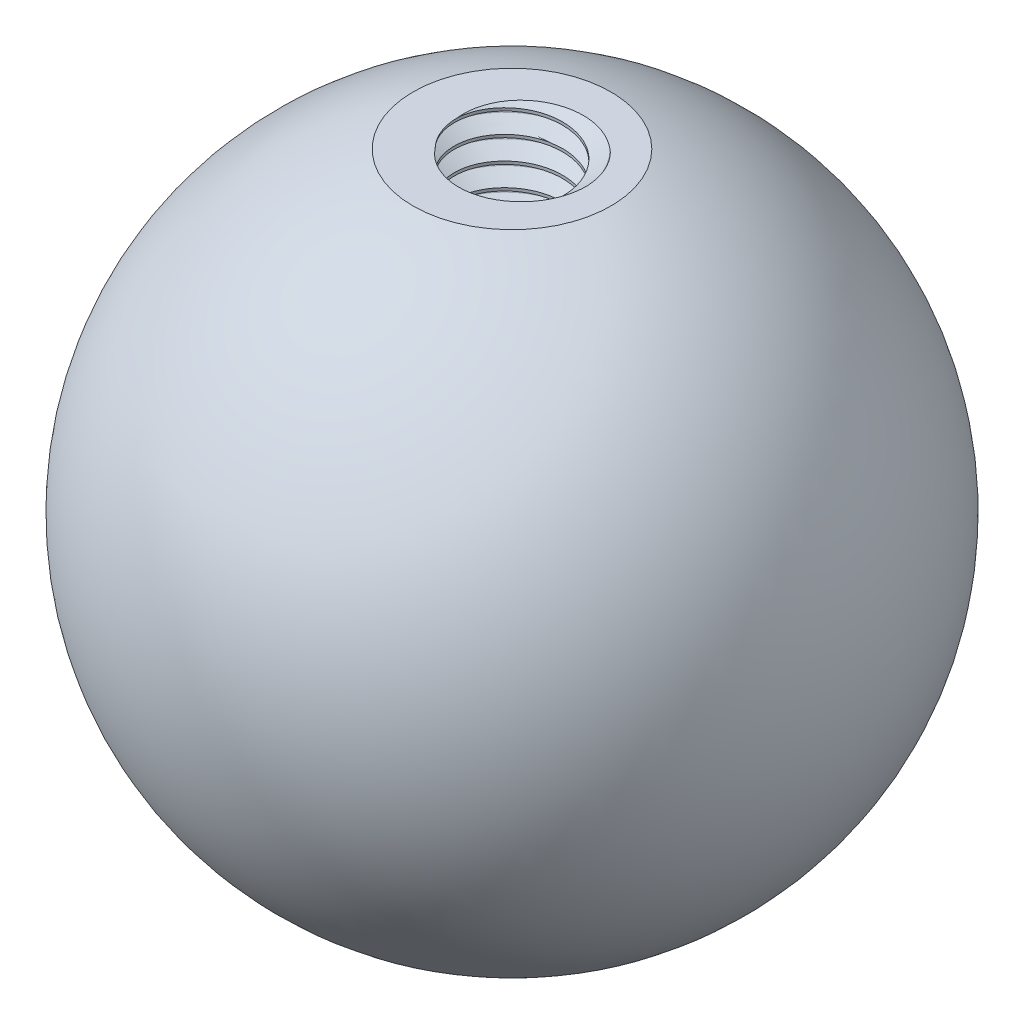
from build123d import *

# Parameters (mm, degrees)
CROQUIS1_R                                     = 3
SALIENTE_EXTRUIR1_DEPTH                        = 14
PERFORADOR_PARA_ROSCAR_PARA_MACHO_DE_ROS_D     = 3.3
PERFORADOR_PARA_ROSCAR_PARA_MACHO_DE_ROS_DEPTH = 11
PERFORADOR_PARA_ROSCAR_PARA_MACHO_DE_ROS_TIP   = 0.991420021
CORTAR_BARRER1_PITCH                           = 0.7


with BuildPart() as part:
    # Croquis1 → Saliente-Extruir1 (new body)
    with BuildSketch(Plane(origin=(0, 0, 0), x_dir=(1, 0, 0), z_dir=(0, 1, 0))):
        with Locations(Location((0, 0, 0), (0, 0, 270))):
            Circle(CROQUIS1_R)
    extrude(amount=SALIENTE_EXTRUIR1_DEPTH)

    # Perforador para roscar para macho de roscar para M4x0.71
    with Locations(Plane.ZX.offset(14)):
        with Locations((0, 0)):
            Hole(PERFORADOR_PARA_ROSCAR_PARA_MACHO_DE_ROS_D / 2, depth=PERFORADOR_PARA_ROSCAR_PARA_MACHO_DE_ROS_DEPTH)
            with Locations((0, 0, -(PERFORADOR_PARA_ROSCAR_PARA_MACHO_DE_ROS_DEPTH + PERFORADOR_PARA_ROSCAR_PARA_MACHO_DE_ROS_TIP / 2))):  # 118° drill point
                Cone(0, PERFORADOR_PARA_ROSCAR_PARA_MACHO_DE_ROS_D / 2, PERFORADOR_PARA_ROSCAR_PARA_MACHO_DE_ROS_TIP, mode=Mode.SUBTRACT)

    # Cortar-Barrer1: arcs per turn and ends read off the stored shape
    # Cortar-Barrer1: the profile of Croquis4 profile screwed along a right-hand helix through 17.666667 turns, 6 arcs to a turn; built about Z, then put on its axis
    cortar_barrer1_z = Axis((0, 0, 0), (0, 0, 1))
    cortar_barrer1_corners = [(2.10466356, 0, -1.049999871), (1.6497, 0, -1.312673205), (1.6497, 0, -0.699826795), (2.10466356, 0, -0.962500129), (2.12992256, 0, -1.00625)]
    with BuildLine(mode=Mode.PRIVATE) as cortar_barrer1_profile:
        Line(cortar_barrer1_corners[0], cortar_barrer1_corners[1])
        Line(cortar_barrer1_corners[1], cortar_barrer1_corners[2])
        Line(cortar_barrer1_corners[2], cortar_barrer1_corners[3])
        ThreePointArc((2.10466356, 0, -0.962500129), (2.123154431, 0, -0.980991), (2.12992256, 0, -1.00625))
        ThreePointArc((2.12992256, 0, -1.00625), (2.123154431, 0, -1.031509), (2.10466356, 0, -1.049999871))
    cortar_barrer1_cap = Face(cortar_barrer1_profile.wire())
    cortar_barrer1_arcs = [((2.10466356, 0, -0.962500129), (2.12992256, 0, -0.977083419), (2.12992256, 0, -1.00625), (1, 0.8660254037844373, 1)), ((2.12992256, 0, -1.00625), (2.12992256, 0, -1.035416581), (2.10466356, 0, -1.049999871), (1, 0.8660254037844373, 1))]  # start, shoulder, end, weights
    cortar_barrer1_turn_angles = [0, 30, 60, 90, 120, 150, 180, 210, 240, 270, 300, 330, 360]
    cortar_barrer1_turn_weights = [1, 0.8660254037844387, 1, 0.8660254037844387, 1, 0.8660254037844387, 1, 0.8660254037844387, 1, 0.8660254037844387, 1, 0.8660254037844387, 1]
    cortar_barrer1_turn_rails = [Edge.make_bspline([Vector(p[0], p[1], 0).rotate(cortar_barrer1_z, cortar_barrer1_turn_angles[k]) / cortar_barrer1_turn_weights[k] + Vector(0, 0, p[2] + CORTAR_BARRER1_PITCH * cortar_barrer1_turn_angles[k] / 360) for k in range(13)], [0, 0, 0, 1, 1, 2, 2, 3, 3, 4, 4, 5, 5, 6, 6, 6], 2, cortar_barrer1_turn_weights) for p in cortar_barrer1_corners]
    cortar_barrer1_turn_sides = [*[Face.make_surface_from_curves(cortar_barrer1_turn_rails[p[0]], cortar_barrer1_turn_rails[p[1]]) for p in [(0, 1), (1, 2), (2, 3)]], *[Face.make_bezier_surface([[Vector(p[j][0], p[j][1], 0).rotate(cortar_barrer1_z, cortar_barrer1_turn_angles[2 * i + k]) / cortar_barrer1_turn_weights[2 * i + k] + Vector(0, 0, p[j][2] + CORTAR_BARRER1_PITCH * cortar_barrer1_turn_angles[2 * i + k] / 360) for k in range(3)] for j in range(3)], [[p[3][j] * cortar_barrer1_turn_weights[2 * i + k] for k in range(3)] for j in range(3)]) for p in cortar_barrer1_arcs for i in range(6)]]
    cortar_barrer1_last_angles = [6120, 6150, 6180, 6210, 6240, 6270, 6300, 6330, 6360]
    cortar_barrer1_last_weights = [1, 0.8660254037844387, 1, 0.8660254037844387, 1, 0.8660254037844387, 1, 0.8660254037844387, 1]
    cortar_barrer1_last_rails = [Edge.make_bspline([Vector(p[0], p[1], 0).rotate(cortar_barrer1_z, cortar_barrer1_last_angles[k]) / cortar_barrer1_last_weights[k] + Vector(0, 0, p[2] + CORTAR_BARRER1_PITCH * cortar_barrer1_last_angles[k] / 360) for k in range(9)], [0, 0, 0, 1, 1, 2, 2, 3, 3, 4, 4, 4], 2, cortar_barrer1_last_weights) for p in cortar_barrer1_corners]
    cortar_barrer1_last_sides = [*[Face.make_surface_from_curves(cortar_barrer1_last_rails[p[0]], cortar_barrer1_last_rails[p[1]]) for p in [(0, 1), (1, 2), (2, 3)]], *[Face.make_bezier_surface([[Vector(p[j][0], p[j][1], 0).rotate(cortar_barrer1_z, cortar_barrer1_last_angles[2 * i + k]) / cortar_barrer1_last_weights[2 * i + k] + Vector(0, 0, p[j][2] + CORTAR_BARRER1_PITCH * cortar_barrer1_last_angles[2 * i + k] / 360) for k in range(3)] for j in range(3)], [[p[3][j] * cortar_barrer1_last_weights[2 * i + k] for k in range(3)] for j in range(3)]) for p in cortar_barrer1_arcs for i in range(4)]]
    cortar_barrer1 = Plane(origin=(0, 14, 0), x_dir=(-1, 0, 0), z_dir=(0, -1, 0)) * Solid(Shell([*[p.moved(Location((0, 0, CORTAR_BARRER1_PITCH * i))) for i in range(17) for p in cortar_barrer1_turn_sides], *cortar_barrer1_last_sides, cortar_barrer1_cap, cortar_barrer1_cap.rotate(cortar_barrer1_z, 6360).moved(Location((0, 0, CORTAR_BARRER1_PITCH * 6360 / 360)))]))
    add(cortar_barrer1, mode=Mode.SUBTRACT)

    # Croquis5 → Revolución1 (revolve)
    with BuildSketch(Plane.XY, mode=Mode.PRIVATE) as revoluci_n1_sk:
        with BuildLine():
            Line((-3, 14), (-2.5, 14))
            Line((-2.5, 14), (-2.5, 0.2))
            Line((-2.5, 0.2), (0, 0.2))
            Line((0, 0.2), (0, -5.539392014))
            ThreePointArc((0, -5.539392014), (-9.884177258, 2.943030993), (-3, 14))
        make_face()
    revolve(revoluci_n1_sk.sketch.rotate(Axis((0, 0.2, 0), (0, -1, 0)), 270), axis=Axis((0, 0.2, 0), (0, -1, 0)))


solid = part.part
